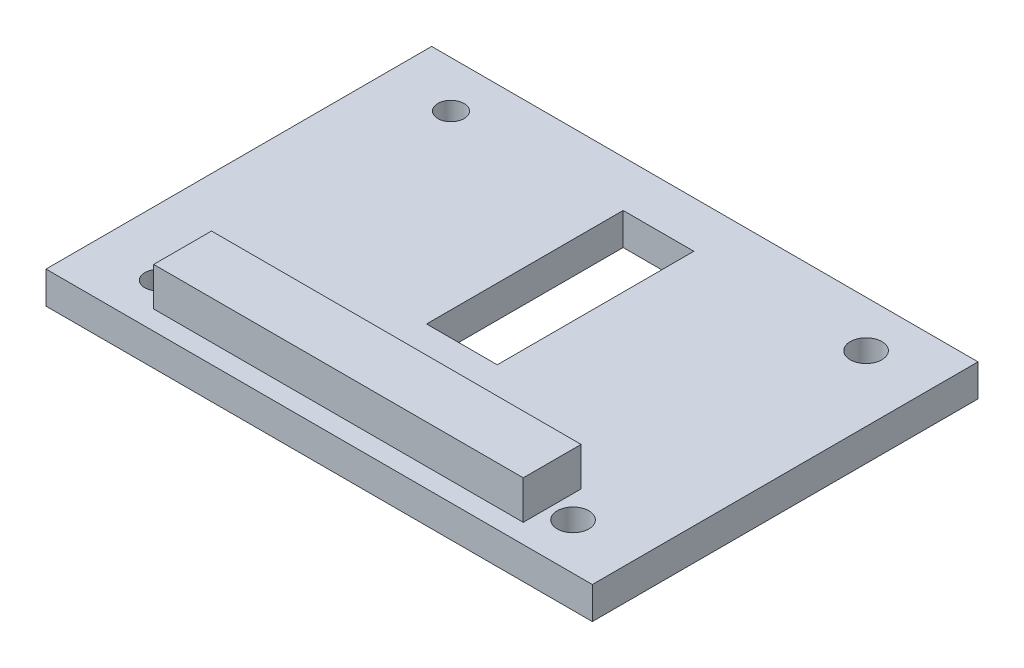
from build123d import *

# Parameters (mm, degrees)
F_01_BASE_PROFILE_W           = 170
F_01_BASE_PROFILE_H           = 120
F_01_BASE_PROFILE_R           = 4.084295612
F_01_BASE_PROFILE_R_2         = 4.915704388
F_01_BASE_PROFILE_W_2         = 22
F_01_BASE_PROFILE_H_2         = 61.1778291
F_01_BASE_EXTRUDE_DEPTH       = 10
F_02_BOSS_PROFILE_W           = 115
F_02_BOSS_PROFILE_H           = 18
F_02_REINFORCEMENT_BOSS_DEPTH = 22


with BuildPart() as part:
    # 01_Base_Profile → 01_Base_Extrude (new body)
    with BuildSketch(Plane(origin=(0, 0, 0), x_dir=(1, 0, 0), z_dir=(0, 1, 0))):
        Rectangle(F_01_BASE_PROFILE_W, F_01_BASE_PROFILE_H)
        with Locations((-64.584295612, -45.58891455)):
            Circle(F_01_BASE_PROFILE_R, mode=Mode.SUBTRACT)
        with Locations((64.584295612, -45.58891455)):
            Circle(F_01_BASE_PROFILE_R_2, mode=Mode.SUBTRACT)
        with Locations((-64.584295612, 45.58891455)):
            Circle(F_01_BASE_PROFILE_R, mode=Mode.SUBTRACT)
        with Locations((64.584295612, 45.58891455)):
            Circle(F_01_BASE_PROFILE_R_2, mode=Mode.SUBTRACT)
        with Locations((0, 15)):
            Rectangle(F_01_BASE_PROFILE_W_2, F_01_BASE_PROFILE_H_2, mode=Mode.SUBTRACT)
    extrude(amount=F_01_BASE_EXTRUDE_DEPTH)

    # 02_Boss_Profile → 02_Reinforcement_Boss (add)
    with BuildSketch(Plane(origin=(0, 0, 0), x_dir=(1, 0, 0), z_dir=(0, 1, 0))):
        with Locations((0, -45)):
            Rectangle(F_02_BOSS_PROFILE_W, F_02_BOSS_PROFILE_H)
    extrude(amount=F_02_REINFORCEMENT_BOSS_DEPTH)


solid = part.part
